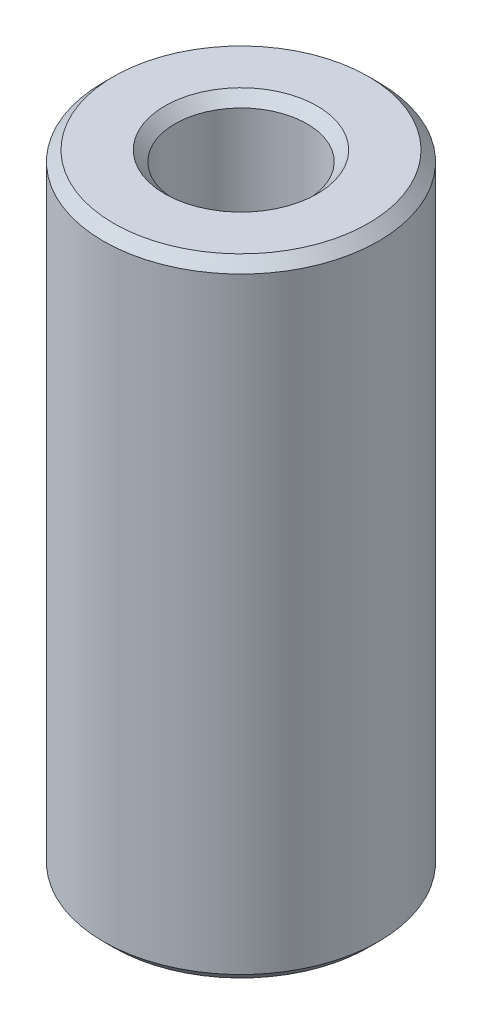
from build123d import *

# Parameters (mm, degrees)
SKETCH1_R           = 30
BOSS_EXTRUDE1_DEPTH = 136.758334221
SKETCH2_R           = 14.376371394
CUT_EXTRUDE1_DEPTH  = 144.18813491
CHAMFER1_SIZE       = 2.238452289


with BuildPart() as part:
    # Sketch1 → Boss-Extrude1 (new body)
    with BuildSketch(Plane(origin=(0, 0, 0), x_dir=(1, 0, 0), z_dir=(0, 1, 0))):
        Circle(SKETCH1_R)
    extrude(amount=BOSS_EXTRUDE1_DEPTH)

    # Sketch2 → Cut-Extrude1 (cut, through all)
    with BuildSketch(Plane(origin=(0, 0, 0), x_dir=(1, 0, 0), z_dir=(0, 1, 0))):
        Circle(SKETCH2_R)
    extrude(amount=CUT_EXTRUDE1_DEPTH, mode=Mode.SUBTRACT)

    # Chamfer1
    chamfer1_edges = [part.edges().sort_by_distance(p)[0] for p in [
        (-14.376371394, 136.758334221, 0),
        (-14.376371394, 0, 0),
        (-30, 0, 0),
        (-30, 136.758334221, 0),
    ]]
    chamfer(chamfer1_edges, length=CHAMFER1_SIZE)


solid = part.part
